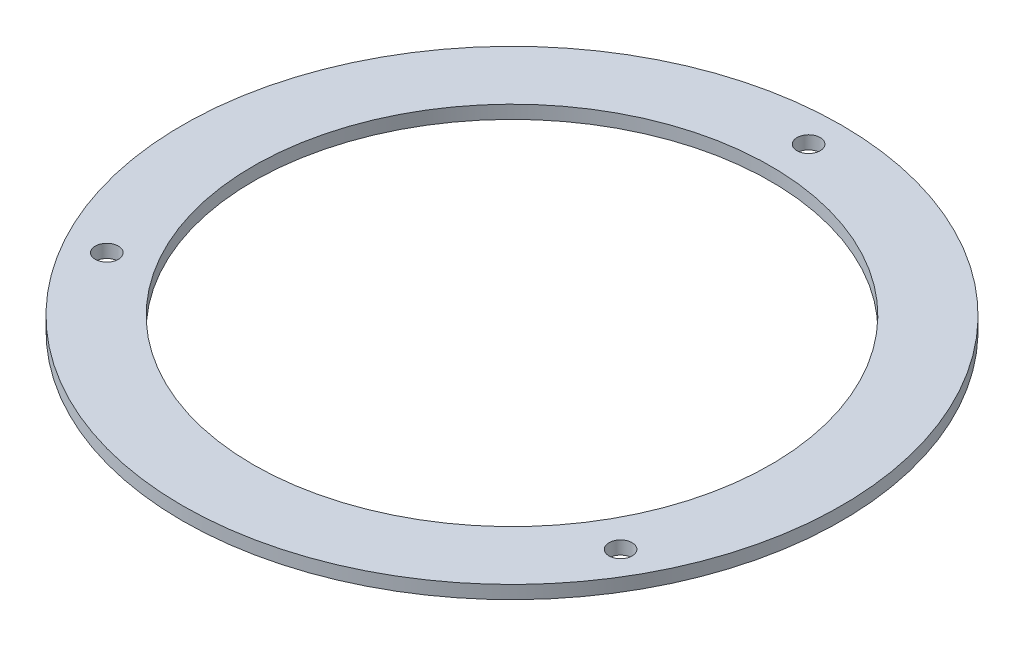
from build123d import *

# Parameters (mm, degrees)
SKETCH1_R           = 50
SKETCH1_R_2         = 39.25
SKETCH1_R_3         = 1.75
BOSS_EXTRUDE1_DEPTH = 2


with BuildPart() as part:
    # Sketch1 → Boss-Extrude1 (new body)
    with BuildSketch(Plane(origin=(0, 0, 0), x_dir=(1, 0, 0), z_dir=(0, 1, 0))):
        Circle(SKETCH1_R)
        Circle(SKETCH1_R_2, mode=Mode.SUBTRACT)
        with Locations((0, 45)):
            Circle(SKETCH1_R_3, mode=Mode.SUBTRACT)
        with Locations((38.97114317, -22.5)):
            Circle(SKETCH1_R_3, mode=Mode.SUBTRACT)
        with Locations((-38.97114317, -22.5)):
            Circle(SKETCH1_R_3, mode=Mode.SUBTRACT)
    extrude(amount=BOSS_EXTRUDE1_DEPTH)


solid = part.part
